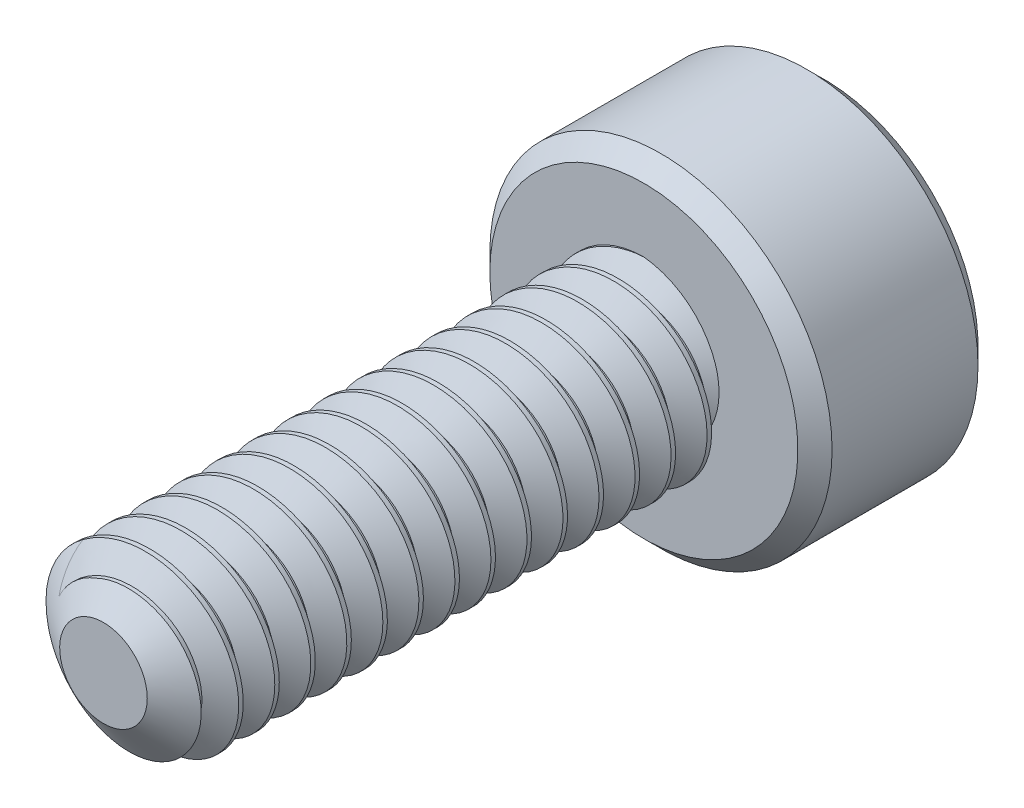
from build123d import *

# Parameters (mm, degrees)
SKETCH1_R          = 1
EXTRUDE1_DEPTH     = 6
CUT_SWEEP1_PITCH   = 0.4
SKETCH6_R          = 1.9
EXTRUDE2_DEPTH     = 2
CUT_EXTRUDE1_DEPTH = 1.125
CHAMFER1_SIZE      = 0.19


with BuildPart() as part:
    # Sketch1 → Extrude1 (new body)
    with BuildSketch(Plane.XY):
        Circle(SKETCH1_R)
    extrude(amount=-EXTRUDE1_DEPTH)

    # Cut-Sweep1: the profile of Sketch3 profile screwed along a right-hand helix of 16 turns, 6 arcs to a turn; built about Z, then put on its axis
    cut_sweep1_z = Axis((0, 0, 0), (0, 0, 1))
    cut_sweep1_corners = [(1.0003, 0, -0.350173205), (0.740192379, 0, -0.2), (0.740192379, 0, -0.15), (1.0003, 0, 0.000173205)]
    with BuildLine(mode=Mode.PRIVATE) as cut_sweep1_profile:
        Line(cut_sweep1_corners[0], cut_sweep1_corners[1])
        Line(cut_sweep1_corners[1], cut_sweep1_corners[2])
        Line(cut_sweep1_corners[2], cut_sweep1_corners[3])
        Line(cut_sweep1_corners[3], cut_sweep1_corners[0])
    cut_sweep1_cap = Face(cut_sweep1_profile.wire())
    cut_sweep1_turn_angles = [0, 30, 60, 90, 120, 150, 180, 210, 240, 270, 300, 330, 360]
    cut_sweep1_turn_weights = [1, 0.8660254037844387, 1, 0.8660254037844387, 1, 0.8660254037844387, 1, 0.8660254037844387, 1, 0.8660254037844387, 1, 0.8660254037844387, 1]
    cut_sweep1_turn_rails = [Edge.make_bspline([Vector(p[0], p[1], 0).rotate(cut_sweep1_z, cut_sweep1_turn_angles[k]) / cut_sweep1_turn_weights[k] + Vector(0, 0, p[2] + CUT_SWEEP1_PITCH * cut_sweep1_turn_angles[k] / 360) for k in range(13)], [0, 0, 0, 1, 1, 2, 2, 3, 3, 4, 4, 5, 5, 6, 6, 6], 2, cut_sweep1_turn_weights) for p in cut_sweep1_corners]
    cut_sweep1_turn_sides = [Face.make_surface_from_curves(cut_sweep1_turn_rails[p[0]], cut_sweep1_turn_rails[p[1]]) for p in [(0, 1), (1, 2), (2, 3), (3, 0)]]
    cut_sweep1 = Plane(origin=(0, 0, 0), x_dir=(0, 1, 0), z_dir=(0, 0, -1)) * Solid(Shell([*[p.moved(Location((0, 0, CUT_SWEEP1_PITCH * i))) for i in range(16) for p in cut_sweep1_turn_sides], cut_sweep1_cap, cut_sweep1_cap.rotate(cut_sweep1_z, 5760).moved(Location((0, 0, CUT_SWEEP1_PITCH * 5760 / 360)))]))
    add(cut_sweep1, mode=Mode.SUBTRACT)

    # Sketch4 → Cut-Revolve1 (revolve, cut)
    with BuildSketch(Plane(origin=(0, 0, 0), x_dir=(0, 0, -1), z_dir=(1, 0, 0)), mode=Mode.PRIVATE) as cut_revolve1_sk:
        Polygon((0.35977197, 1), (0, 0.486192379), (0, 1), align=None)
    revolve(cut_revolve1_sk.sketch.rotate(Axis((0, 0, 0), (0, 0, -1)), 278.428757721), axis=Axis((0, 0, 0), (0, 0, -1)), mode=Mode.SUBTRACT)

    # Sketch6 → Extrude2 (add)
    with BuildSketch(Plane(origin=(0, 0, -6), x_dir=(-1, 0, 0), z_dir=(0, 0, -1))):
        Circle(SKETCH6_R)
    extrude(amount=EXTRUDE2_DEPTH)

    # Sketch7 → Cut-Extrude1 (cut)
    with BuildSketch(Plane(origin=(0, 0, -8), x_dir=(-1, 0, 0), z_dir=(0, 0, -1))):
        Polygon((0, 0.866025404), (-0.75, 0.433012702), (-0.75, -0.433012702), (0, -0.866025404), (0.75, -0.433012702), (0.75, 0.433012702), align=None)
    extrude(amount=-CUT_EXTRUDE1_DEPTH, mode=Mode.SUBTRACT)

    # Cut-Extrude2 cone 1 section (through the dimple's axis) → Cut-Extrude2 (revolve, cut)
    with BuildSketch(Plane(origin=(0, 0, -8), x_dir=(0, 1, 0), z_dir=(1, 0, 0))):
        Polygon((0, 0), (0.866025404, 0), (0, 0.866025404), align=None)
    revolve(axis=Axis((0, 0, -8), (0, 0, 1)), mode=Mode.SUBTRACT)

    # Chamfer1
    chamfer1_edges = [part.edges().sort_by_distance(p)[0] for p in [
        (1.9, 0, -6),
        (1.9, 0, -8),
    ]]
    chamfer(chamfer1_edges, length=CHAMFER1_SIZE)


solid = part.part
